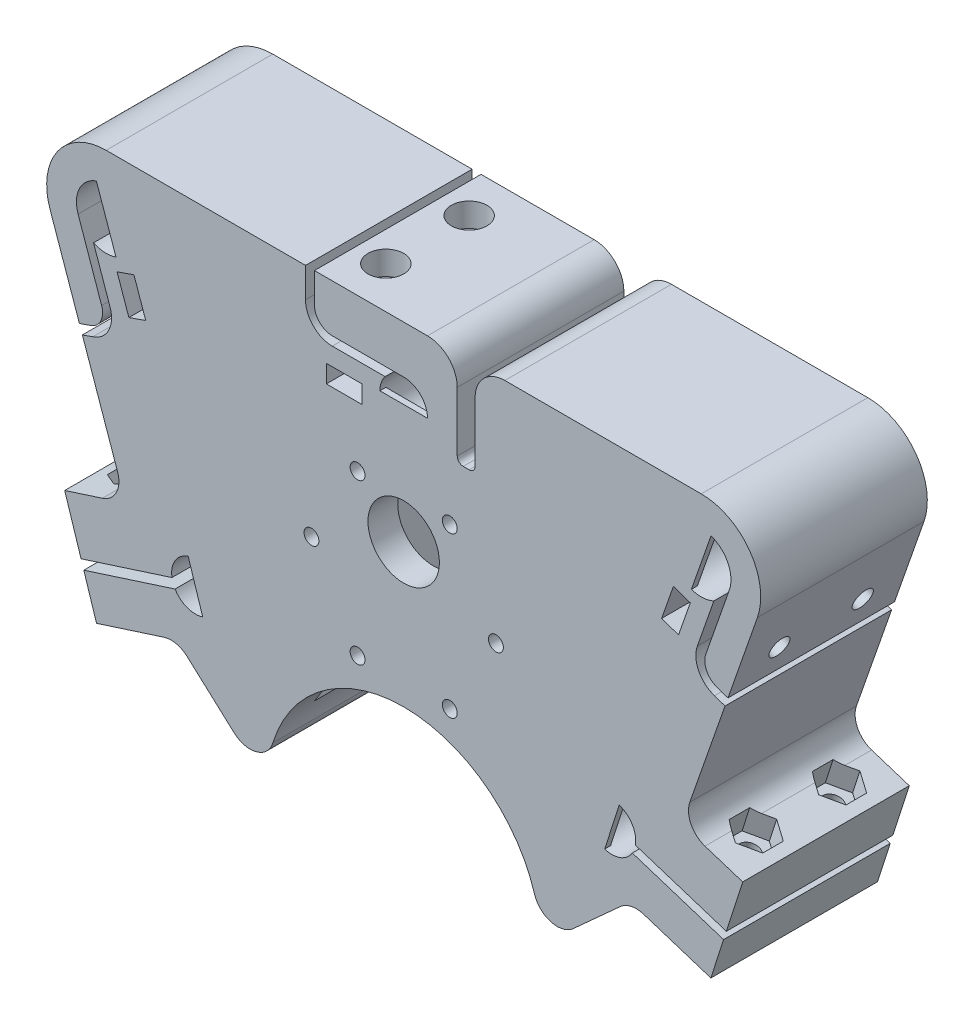
from build123d import *

# Parameters (mm, degrees)
SZKIC1_R                    = 1.25
SZKIC1_R_2                  = 6
DODANIE_WYCI_GNI_CIE1_DEPTH = 28
ZAOKR_GLENIE1_R             = 4
SZKIC2_R                    = 1.7
WYTNIJ_WYCI_GNI_CIE1_DEPTH  = 92.934955481
SZKIC3_R                    = 3
WYTNIJ_WYCI_GNI_CIE2_DEPTH  = 3
WYTNIJ_WYCI_GNI_CIE3_DEPTH  = 4
SZKIC5_R                    = 1.7
WYTNIJ_WYCI_GNI_CIE4_DEPTH  = 10
WYTNIJ_WYCI_GNI_CIE5_START  = -9.5
WYTNIJ_WYCI_GNI_CIE5_DEPTH  = 3
SZKIC7_R                    = 1.7
WYTNIJ_WYCI_GNI_CIE6_DEPTH  = 14
WYTNIJ_WYCI_GNI_CIE7_START  = -12.5
WYTNIJ_WYCI_GNI_CIE7_DEPTH  = 3
DODANIE_WYCI_GNI_CIE2_START = -1
DODANIE_WYCI_GNI_CIE2_DEPTH = 1
WYTNIJ_WYCI_GNI_CIE8_DEPTH  = 23
SZKIC14_R                   = 3
WYTNIJ_WYCI_GNI_CIE9_DEPTH  = 4
SZKIC15_R                   = 2
WYTNIJ_WYCI_GNI_CIE10_DEPTH = 10


with BuildPart() as part:
    # Szkic1 → Dodanie-wyciągnięcie1 (new body)
    with BuildSketch(Plane.XY):
        with BuildLine():
            Line((-16.5, 10), (-50, 10))
            ThreePointArc((-50, 10), (-58.153539415, 5.789628228), (-59.44119239, -3.296040997))
            Line((-59.44119239, -3.296040997), (-54.497130895, -17.457829582))
            Line((-54.497130895, -17.457829582), (-52.608892417, -16.798621383))
            ThreePointArc((-52.608892417, -16.798621383), (-50.895729486, -15.269847132), (-50.765346999, -12.977451367))
            Line((-50.765346999, -12.977451367), (-54.720596195, -1.648020498))
            ThreePointArc((-54.720596195, -1.648020498), (-46.287105711, 3.348793215), (-52.124779238, -4.526070392))
            Line((-52.124779238, -4.526070392), (-49.347144245, -12.482338649))
            ThreePointArc((-49.347144245, -12.482338649), (-49.573478973, -15.984903044), (-52.245639943, -18.260587666))
            Line((-52.245639943, -18.260587666), (-54.002724745, -18.874008441))
            Line((-54.002724745, -18.874008441), (-46.73072499, -39.703952248))
            Line((-46.73072499, -39.703952248), (-56.971706107, -42.992648268))
            Line((-56.971706107, -42.992648268), (-54.219935067, -51.561647984))
            Line((-54.219935067, -51.561647984), (-38.945736554, -46.656630069))
            ThreePointArc((-38.945736554, -46.656630069), (-31.247605059, -44.614528164), (-38.425704632, -48.065078151))
            Line((-38.425704632, -48.065078151), (-53.76130656, -52.989814604))
            Line((-53.76130656, -52.989814604), (-51.621040196, -59.654592161))
            Line((-51.621040196, -59.654592161), (-38.116801548, -55.317963143))
            Line((-38.116801548, -55.317963143), (-23, -69))
            ThreePointArc((-23, -69), (0, -46), (23, -69))
            Line((23, -69), (38.116801548, -55.317963143))
            Line((38.116801548, -55.317963143), (51.621040196, -59.654592161))
            Line((51.621040196, -59.654592161), (53.76130656, -52.989814604))
            Line((53.76130656, -52.989814604), (38.425704632, -48.065078151))
            ThreePointArc((38.425704632, -48.065078151), (31.247605059, -44.614528164), (38.945736554, -46.656630069))
            Line((38.945736554, -46.656630069), (54.219935067, -51.561647984))
            Line((54.219935067, -51.561647984), (56.971706107, -42.992648268))
            Line((56.971706107, -42.992648268), (46.73072499, -39.703952248))
            Line((46.73072499, -39.703952248), (54.002724745, -18.874008441))
            Line((54.002724745, -18.874008441), (52.245639943, -18.260587666))
            ThreePointArc((52.245639943, -18.260587666), (49.573478973, -15.984903044), (49.347144245, -12.482338649))
            Line((49.347144245, -12.482338649), (52.124779238, -4.526070392))
            ThreePointArc((52.124779238, -4.526070392), (46.287105711, 3.348793215), (54.720596195, -1.648020498))
            Line((54.720596195, -1.648020498), (50.765346999, -12.977451367))
            ThreePointArc((50.765346999, -12.977451367), (50.895729486, -15.269847132), (52.608892417, -16.798621383))
            Line((52.608892417, -16.798621383), (54.497130895, -17.457829582))
            Line((54.497130895, -17.457829582), (59.44119239, -3.296040997))
            ThreePointArc((59.44119239, -3.296040997), (58.153539415, 5.789628228), (50, 10))
            Line((50, 10), (17, 10))
            ThreePointArc((17, 10), (13.464466094, 8.535533906), (12, 5))
            Line((12, 5), (12, -5))
            ThreePointArc((12, -5), (11.707106781, -5.707106781), (11, -6))
            Line((11, -6), (10, -6))
            ThreePointArc((10, -6), (9.292893219, -5.707106781), (9, -5))
            Line((9, -5), (9, 5))
            ThreePointArc((9, 5), (7.535533906, 8.535533906), (4, 10))
            Line((4, 10), (-15, 10))
            Line((-15, 10), (-15, 5))
            ThreePointArc((-15, 5), (-14.121320344, 2.878679656), (-12, 2))
            Line((-12, 2), (0, 2))
            ThreePointArc((0, 2), (1.732050808, -5.605551275), (-3.122498999, 0.5))
            Line((-3.122498999, 0.5), (-12, 0.5))
            ThreePointArc((-12, 0.5), (-15.181980515, 1.818019485), (-16.5, 5))
            Line((-16.5, 5), (-16.5, 10))
        make_face()
        with Locations((-7.75, -42.423393759)):
            Circle(SZKIC1_R, mode=Mode.SUBTRACT)
        with Locations((7.75, -42.423393759)):
            Circle(SZKIC1_R, mode=Mode.SUBTRACT)
        with Locations((-15.5, -29)):
            Circle(SZKIC1_R, mode=Mode.SUBTRACT)
        with Locations((0, -22)):
            Circle(SZKIC1_R_2, mode=Mode.SUBTRACT)
        with Locations((-7.75, -15.576606241)):
            Circle(SZKIC1_R, mode=Mode.SUBTRACT)
        with Locations((15.5, -29)):
            Circle(SZKIC1_R, mode=Mode.SUBTRACT)
        with Locations((7.75, -15.576606241)):
            Circle(SZKIC1_R, mode=Mode.SUBTRACT)
    extrude(amount=DODANIE_WYCI_GNI_CIE1_DEPTH)

    # Zaokrąglenie1
    zaokr_glenie1_edges = [part.edges().sort_by_distance(p)[0] for p in [
        (-46.73072499, -39.703952248, 14),
        (-38.116801548, -55.317963143, 14),
        (-23, -69, 14),
        (23, -69, 14),
        (38.116801548, -55.317963143, 14),
        (46.73072499, -39.703952248, 14),
    ]]
    fillet(zaokr_glenie1_edges, radius=ZAOKR_GLENIE1_R)

    # Szkic2 → Wytnij-wyciągnięcie1 (cut, through all)
    with BuildSketch(Plane(origin=(12.540292842, -39.050402177, 0), x_dir=(0.9521110796259562, 0.3057523377727409, 0), z_dir=(0.3057523377727409, -0.9521110796259562, 0))):
        with Locations((-62.388495324, 21)):
            Circle(SZKIC2_R)
        with Locations((-62.388495324, 7)):
            Circle(SZKIC2_R)
    wytnij_wyci_gni_cie1 = extrude(amount=-WYTNIJ_WYCI_GNI_CIE1_DEPTH, mode=Mode.SUBTRACT)

    # Szkic3 → Wytnij-wyciągnięcie2 (cut)
    with BuildSketch(Plane(origin=(12.540292842, -39.050402177, 0), x_dir=(0.9521110796259562, 0.3057523377727409, 0), z_dir=(0.3057523377727409, -0.9521110796259562, 0))):
        with Locations((-62.388495324, 21)):
            Circle(SZKIC3_R)
        with Locations((-62.388495324, 7)):
            Circle(SZKIC3_R)
    wytnij_wyci_gni_cie2 = extrude(amount=-WYTNIJ_WYCI_GNI_CIE2_DEPTH, mode=Mode.SUBTRACT)

    # Szkic4 → Wytnij-wyciągnięcie3 (cut, symmetric)
    with BuildSketch(Plane(origin=(7.189626931, -22.388458283, 0), x_dir=(0.9521110796259562, 0.30575233777274063, 0), z_dir=(-0.30575233777274063, 0.9521110796259562, 0))):
        Polygon((-62.388495324, -24.464101615), (-59.388495324, -22.732050808), (-59.388495324, -19.267949192), (-62.388495324, -17.535898385), (-65.388495324, -19.267949192), (-65.388495324, -22.732050808), align=None)
        Polygon((-62.388495324, -10.464101615), (-59.388495324, -8.732050808), (-59.388495324, -5.267949192), (-62.388495324, -3.535898385), (-65.388495324, -5.267949192), (-65.388495324, -8.732050808), align=None)
    wytnij_wyci_gni_cie3 = extrude(amount=WYTNIJ_WYCI_GNI_CIE3_DEPTH, both=True, mode=Mode.SUBTRACT)

    # Szkic5 → Wytnij-wyciągnięcie4 (cut)
    with BuildSketch(Plane(origin=(-54.009249264, -18.855319585, 0), x_dir=(0, 0, 1), z_dir=(-0.944119239013413, -0.3296040996782867, 0))):
        with Locations((21, 6.480204984)):
            Circle(SZKIC5_R)
        with Locations((7, 6.480204984)):
            Circle(SZKIC5_R)
    wytnij_wyci_gni_cie4 = extrude(amount=-WYTNIJ_WYCI_GNI_CIE4_DEPTH, mode=Mode.SUBTRACT)

    # Szkic6 → Wytnij-wyciągnięcie5 (cut)
    with BuildSketch(Plane(origin=(-54.009249264, -18.855319585, 0), x_dir=(0, 0, 1), z_dir=(-0.944119239013413, -0.3296040996782867, 0)).offset(WYTNIJ_WYCI_GNI_CIE5_START)):
        Polygon((28, 9.480204984), (19.267949192, 9.480204984), (17.535898385, 6.480204984), (19.267949192, 3.480204984), (28, 3.480204984), align=None)
        Polygon((8.732050808, 3.480204984), (10.464101615, 6.480204984), (8.732050808, 9.480204984), (0, 9.480204984), (0, 3.480204984), align=None)
    wytnij_wyci_gni_cie5 = extrude(amount=-WYTNIJ_WYCI_GNI_CIE5_DEPTH, mode=Mode.SUBTRACT)

    # Lustro1: Wytnij-wyciągnięcie1, Wytnij-wyciągnięcie2, Wytnij-wyciągnięcie3, Wytnij-wyciągnięcie4, Wytnij-wyciągnięcie5 across plane
    add(wytnij_wyci_gni_cie1.mirror(Plane(origin=(0, 0, 0), x_dir=(0, 0, 1), z_dir=(1, 0, 0))), mode=Mode.SUBTRACT)
    add(wytnij_wyci_gni_cie2.mirror(Plane(origin=(0, 0, 0), x_dir=(0, 0, 1), z_dir=(1, 0, 0))), mode=Mode.SUBTRACT)
    add(wytnij_wyci_gni_cie3.mirror(Plane(origin=(0, 0, 0), x_dir=(0, 0, 1), z_dir=(1, 0, 0))), mode=Mode.SUBTRACT)
    add(wytnij_wyci_gni_cie4.mirror(Plane(origin=(0, 0, 0), x_dir=(0, 0, 1), z_dir=(1, 0, 0))), mode=Mode.SUBTRACT)
    add(wytnij_wyci_gni_cie5.mirror(Plane(origin=(0, 0, 0), x_dir=(0, 0, 1), z_dir=(1, 0, 0))), mode=Mode.SUBTRACT)

    # Szkic7 → Wytnij-wyciągnięcie6 (cut)
    with BuildSketch(Plane(origin=(0, 10, 0), x_dir=(1, 0, 0), z_dir=(0, 1, 0))):
        with Locations((-10, -21)):
            Circle(SZKIC7_R)
        with Locations((-10, -7)):
            Circle(SZKIC7_R)
    extrude(amount=-WYTNIJ_WYCI_GNI_CIE6_DEPTH, mode=Mode.SUBTRACT)

    # Szkic8 → Wytnij-wyciągnięcie7 (cut)
    with BuildSketch(Plane(origin=(0, 10, 0), x_dir=(1, 0, 0), z_dir=(0, 1, 0)).offset(WYTNIJ_WYCI_GNI_CIE7_START)):
        Polygon((-7, -28), (-7, -19.267949192), (-10, -17.535898385), (-13, -19.267949192), (-13, -28), align=None)
        Polygon((-13, -8.732050808), (-10, -10.464101615), (-7, -8.732050808), (-7, 0), (-13, 0), align=None)
    extrude(amount=-WYTNIJ_WYCI_GNI_CIE7_DEPTH, mode=Mode.SUBTRACT)

    # Szkic9 → Dodanie-wyciągnięcie2 (add)
    with BuildSketch(Plane.XY.offset(28).offset(DODANIE_WYCI_GNI_CIE2_START)):
        with BuildLine():
            ThreePointArc((-33.776990649, -49.808444319), (-31.191555681, -44.776990649), (-36.223009351, -42.191555681))
            Line((-36.223009351, -42.191555681), (-33.776990649, -49.808444319))
        make_face()
        with BuildLine():
            Line((-51.648020498, 4.720596195), (-48.351979502, -4.720596195))
            ThreePointArc((-48.351979502, -4.720596195), (-45.279403805, 1.648020498), (-51.648020498, 4.720596195))
        make_face()
        with BuildLine():
            ThreePointArc((36.223009351, -42.191555681), (31.191555681, -44.776990649), (33.776990649, -49.808444319))
            Line((33.776990649, -49.808444319), (36.223009351, -42.191555681))
        make_face()
        with BuildLine():
            Line((4, -2), (-4, -2))
            ThreePointArc((-4, -2), (0, -6), (4, -2))
        make_face()
        with BuildLine():
            ThreePointArc((51.648020498, 4.720596195), (45.279403805, 1.648020498), (48.351979502, -4.720596195))
            Line((48.351979502, -4.720596195), (51.648020498, 4.720596195))
        make_face()
    extrude(amount=DODANIE_WYCI_GNI_CIE2_DEPTH)

    # Szkic10 → Wytnij-wyciągnięcie8 (cut)
    with BuildSketch(Plane(origin=(0, 0, 0), x_dir=(-1, 0, 0), z_dir=(0, 0, -1))):
        with BuildLine():
            ThreePointArc((20, -29), (0, -9), (-20, -29))
            Line((-20, -29), (-20, -58.870079081))
            Line((-20, -58.870079081), (20, -58.870079081))
            Line((20, -58.870079081), (20, -29))
        make_face()
    extrude(amount=-WYTNIJ_WYCI_GNI_CIE8_DEPTH, mode=Mode.SUBTRACT)

    # Szkic14 → Wytnij-wyciągnięcie9 (cut)
    with BuildSketch(Plane(origin=(0, 10, 0), x_dir=(1, 0, 0), z_dir=(0, 1, 0))):
        with Locations((-10, -7)):
            Circle(SZKIC14_R)
        with Locations((-10, -21)):
            Circle(SZKIC14_R)
    extrude(amount=-WYTNIJ_WYCI_GNI_CIE9_DEPTH, mode=Mode.SUBTRACT)

    # Szkic15 → Wytnij-wyciągnięcie10 (cut)
    with BuildSketch(Plane(origin=(44.686134046, -49.372138619, 0), x_dir=(0.741415455355594, 0.6710462894315542, 0), z_dir=(0.6710462894315542, -0.741415455355594, 0))):
        with Locations((-16.842795666, 21)):
            Circle(SZKIC15_R)
        with Locations((-16.842795666, 7)):
            Circle(SZKIC15_R)
    wytnij_wyci_gni_cie10 = extrude(amount=-WYTNIJ_WYCI_GNI_CIE10_DEPTH, mode=Mode.SUBTRACT)

    # Lustro2: Wytnij-wyciągnięcie10 across plane
    add(wytnij_wyci_gni_cie10.mirror(Plane(origin=(0, 0, 0), x_dir=(0, 0, 1), z_dir=(1, 0, 0))), mode=Mode.SUBTRACT)


solid = part.part
